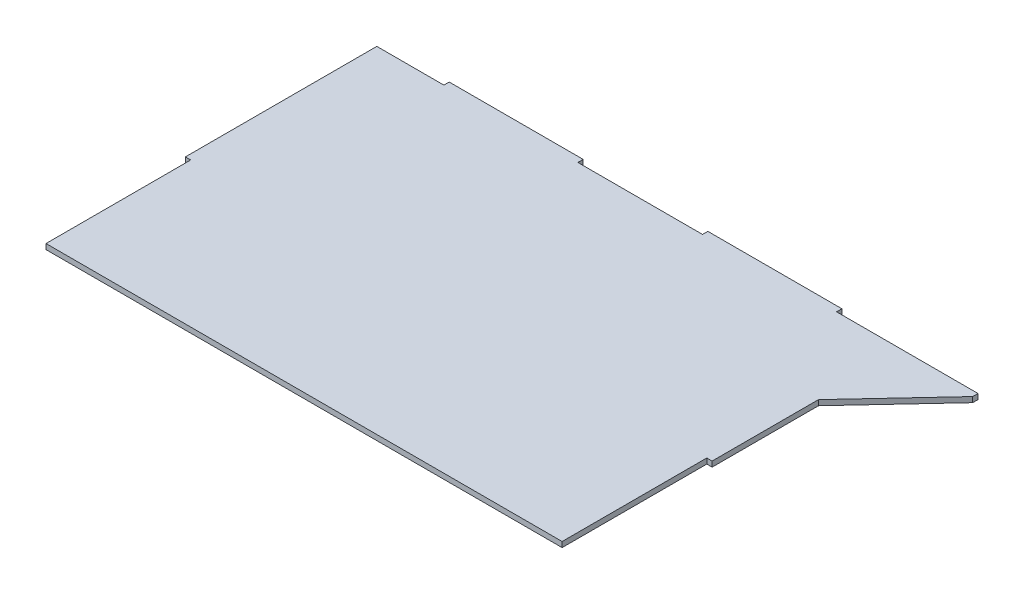
from build123d import *

# Parameters (mm, degrees)
SKETCH1_W           = 314.4612
SKETCH1_H           = 3.175
BOSS_EXTRUDE1_DEPTH = 200.66180012
CUT_EXTRUDE2_START  = -3.175
SKETCH5_W           = 3.175
SKETCH5_H           = 86.36
CUT_EXTRUDE2_DEPTH  = 259.119504214
SKETCH3_W           = 80
SKETCH3_H           = 3.175
BOSS_EXTRUDE2_DEPTH = 3.175
LPATTERN2_COUNT     = 2
LPATTERN2_PITCH     = 154.43
BOSS_EXTRUDE3_DEPTH = 3.175


with BuildPart() as part:
    # Sketch1 → Boss-Extrude1 (new body)
    with BuildSketch(Plane.XY):
        Rectangle(SKETCH1_W, SKETCH1_H)
    extrude(amount=BOSS_EXTRUDE1_DEPTH)

    # Sketch5 → Cut-Extrude2 (cut)
    with BuildSketch(Plane(origin=(0, 1.5875, 0), x_dir=(1, 0, 0), z_dir=(0, 1, 0)).offset(CUT_EXTRUDE2_START)):
        with Locations((-155.6431, -157.48180012)):
            Rectangle(SKETCH5_W, SKETCH5_H)
    cut_extrude2 = extrude(amount=CUT_EXTRUDE2_DEPTH, mode=Mode.SUBTRACT)

    # Mirror1: Cut-Extrude2 across plane
    add(cut_extrude2.mirror(Plane(origin=(0, 0, 0), x_dir=(0, 0, 1), z_dir=(1, 0, 0))), mode=Mode.SUBTRACT)

    # Sketch3 → Boss-Extrude2 (add)
    with BuildSketch(Plane(origin=(0, 0, 0), x_dir=(-1, 0, 0), z_dir=(0, 0, -1))):
        with Locations((-77.2306, 0)):
            Rectangle(SKETCH3_W, SKETCH3_H)
    boss_extrude2 = extrude(amount=BOSS_EXTRUDE2_DEPTH)

    # LPattern2: Boss-Extrude2 ×2
    with Locations(*[(-i * LPATTERN2_PITCH, 0, 0) for i in range(1, LPATTERN2_COUNT)]):
        add(boss_extrude2)

    # Sketch10 → Boss-Extrude3 (add)
    with BuildSketch(Plane.XZ.offset(1.5875)):
        Polygon((201.66536, 0), (201.66536, 3.175), (157.2306, 50.8), (157.2306, 0), align=None)
    extrude(amount=-BOSS_EXTRUDE3_DEPTH)


solid = part.part
